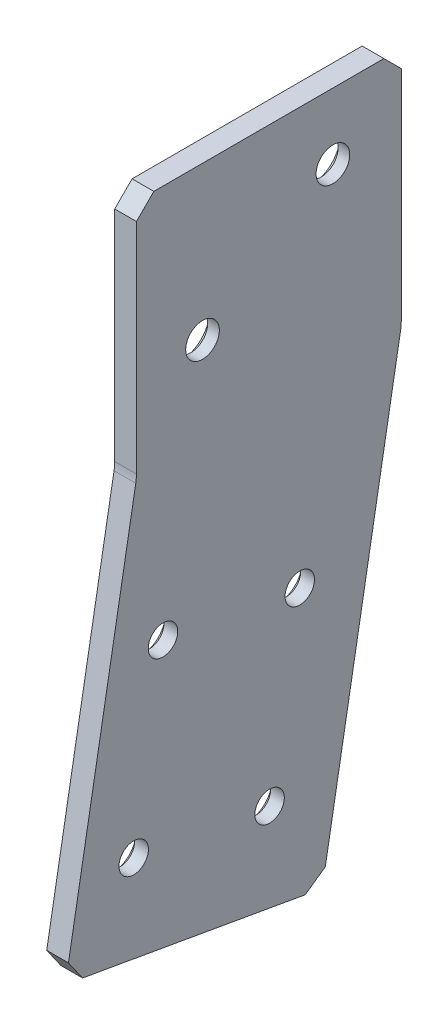
from build123d import *

# Parameters (mm, degrees)
BOSS_EXTRUDE1_DEPTH                               = 3.175
FILLET1_R                                         = 6.35
CSK_FOR_6_FLAT_HEAD_MACHINE_SCREW_100_D           = 4.3053
CSK_FOR_6_FLAT_HEAD_MACHINE_SCREW_100_CSINK_D     = 7.0866
CSK_FOR_6_FLAT_HEAD_MACHINE_SCREW_100_CSINK_ANGLE = 100
CSK_FOR_8_FLAT_HEAD_MACHINE_SCREW_2_COUNT         = 2
CSK_FOR_8_FLAT_HEAD_MACHINE_SCREW_2_PITCH         = 22.895250599
CHAMFER1_SIZE                                     = 2.54


with BuildPart() as part:
    # Sketch1 → Boss-Extrude1 (new body)
    with BuildSketch(Plane.ZY.offset(-5.035827965)):
        Polygon((-147.77562455, 230.070458845), (-159.314588786, 295.511176933), (-159.314588786, 330.563176933), (-120.626834873, 330.563176933), (-120.626834873, 295.511176933), (-110.25444916, 236.686454414), align=None)
    extrude(amount=BOSS_EXTRUDE1_DEPTH)

    # Fillet1
    fillet1_edges = [part.edges().sort_by_distance(p)[0] for p in [
        (3.448327965, 295.511176933, -120.626834873),
        (3.448327965, 295.511176933, -159.314588786),
    ]]
    fillet(fillet1_edges, radius=FILLET1_R)

    # CSK for #6 Flat Head Machine Screw (100)1 (through all)
    with Locations(Plane.ZY.offset(-1.860827965)):
        with Locations((-124.504125043, 273.139415456), (-144.485224025, 269.724179148), (-140.075144867, 244.324179148), (-120.227402214, 247.716621746)):
            CounterSinkHole(CSK_FOR_6_FLAT_HEAD_MACHINE_SCREW_100_D / 2, CSK_FOR_6_FLAT_HEAD_MACHINE_SCREW_100_CSINK_D / 2, counter_sink_angle=CSK_FOR_6_FLAT_HEAD_MACHINE_SCREW_100_CSINK_ANGLE)

    # Sketch5 → CSK for #8 Flat Head Machine Screw (100)1 (revolve, cut)
    with BuildSketch(Plane(origin=(1.860827965, 320.911176933, -149.328834873), x_dir=(0, 0, 1), z_dir=(0, 1, 0))):
        Polygon((0, 0), (0, 3.175), (2.45745, 3.175), (2.45745, 1.475934296), (4.2164, 0), align=None)
    csk_for_8_flat_head_machine_screw_100 = revolve(axis=Axis((-4.489172035, 320.911176933, -149.328834873), (1, 0, 0)), mode=Mode.SUBTRACT)

    # CSK for _8 Flat Head Machine Screw _ 2: CSK for #8 Flat Head Machine Screw (100)1 ×2
    with Locations(*[Vector(0, -0.5547001962252293, 0.8320502943378436) * (i * CSK_FOR_8_FLAT_HEAD_MACHINE_SCREW_2_PITCH) for i in range(1, CSK_FOR_8_FLAT_HEAD_MACHINE_SCREW_2_COUNT)]):
        add(csk_for_8_flat_head_machine_screw_100, mode=Mode.SUBTRACT)

    # Chamfer1
    chamfer1_edges = [part.edges().sort_by_distance(p)[0] for p in [
        (3.448327965, 236.686454414, -110.25444916),
        (3.448327965, 230.070458845, -147.77562455),
        (3.448327965, 330.563176933, -159.314588786),
        (3.448327965, 330.563176933, -120.626834873),
    ]]
    chamfer(chamfer1_edges, length=CHAMFER1_SIZE)


solid = part.part
